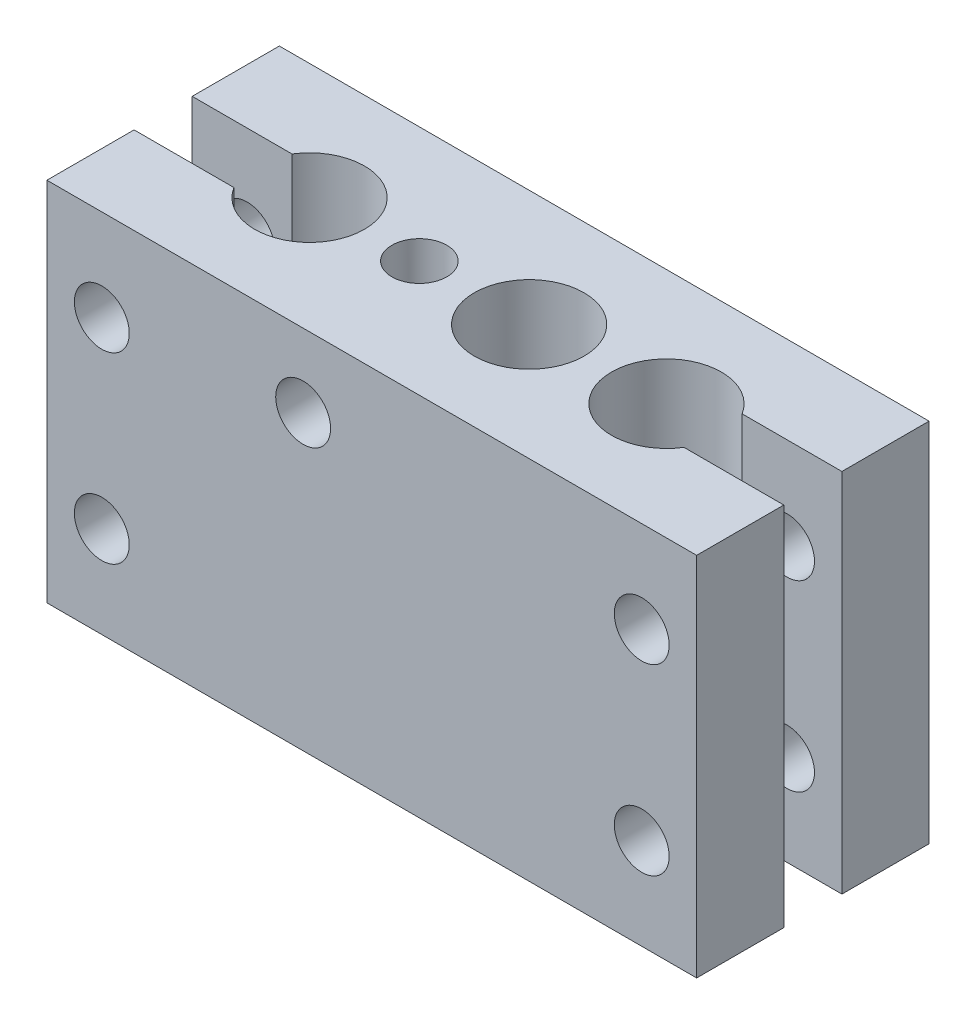
from build123d import *

# Parameters (mm, degrees)
SKETCH1_W               = 35.5
SKETCH1_H               = 20
BOSS_EXTRUDE1_DEPTH     = 6.35
CUT_EXTRUDE1_DEPTH      = 28.484268227
CUT_EXTRUDE1_DEPTH_BACK = 28.484268227
SKETCH2_R               = 3
SKETCH2_R_2             = 1.5
CUT_EXTRUDE2_DEPTH      = 25.007342627
CUT_EXTRUDE2_DEPTH_BACK = 25.007342627
SKETCH3_R               = 1.5


with BuildPart() as part:
    # Sketch1 → Boss-Extrude1 (new, symmetric)
    with BuildSketch(Plane.XY):
        Rectangle(SKETCH1_W, SKETCH1_H)
    extrude(amount=BOSS_EXTRUDE1_DEPTH, both=True)

    # Sketch2 → Cut-Extrude1 (cut, two sides: drawn at the far end of the back side and taken through both)
    with BuildSketch(Plane(origin=(0, 10, 0), x_dir=(1, 0, 0), z_dir=(0, 1, 0)).offset(-CUT_EXTRUDE1_DEPTH_BACK)):
        with BuildLine():
            Line((-17.75, -1.5875), (-12.295553722, -1.5875))
            ThreePointArc((-12.295553722, -1.5875), (-6.75, 0), (-12.295553722, 1.5875))
            Line((-12.295553722, 1.5875), (-17.75, 1.5875))
            Line((-17.75, 1.5875), (-17.75, -1.5875))
        make_face()
        with BuildLine():
            Line((17.75, 1.5875), (12.295553722, 1.5875))
            ThreePointArc((12.295553722, 1.5875), (6.75, 0), (12.295553722, -1.5875))
            Line((12.295553722, -1.5875), (17.75, -1.5875))
            Line((17.75, -1.5875), (17.75, 1.5875))
        make_face()
        with Locations((2.25, 0)):
            Circle(SKETCH2_R)
        with Locations((-3.75, 0)):
            Circle(SKETCH2_R_2)
    extrude(amount=CUT_EXTRUDE1_DEPTH + CUT_EXTRUDE1_DEPTH_BACK, mode=Mode.SUBTRACT)

    # Sketch3 → Cut-Extrude2 (cut, two sides: drawn at the far end of the back side and taken through both)
    with BuildSketch(Plane.XY.offset(6.35).offset(-CUT_EXTRUDE2_DEPTH_BACK)):
        with Locations((14.75, 5)):
            Circle(SKETCH3_R)
        with Locations((14.75, -5)):
            Circle(SKETCH3_R)
        with Locations((-3.75, 6)):
            Circle(SKETCH3_R)
        with Locations((-14.75, -5)):
            Circle(SKETCH3_R)
        with Locations((-14.75, 5)):
            Circle(SKETCH3_R)
    extrude(amount=CUT_EXTRUDE2_DEPTH + CUT_EXTRUDE2_DEPTH_BACK, mode=Mode.SUBTRACT)


solid = part.part
